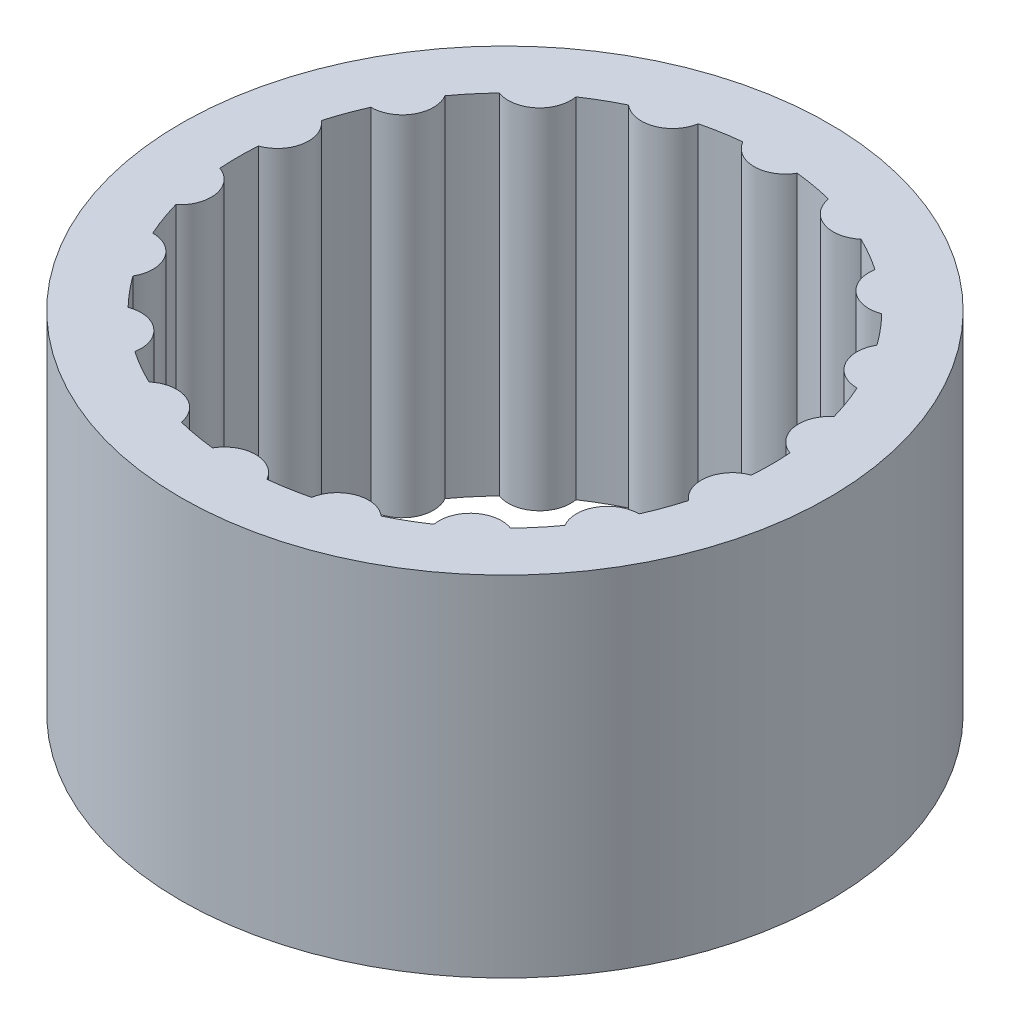
from build123d import *
from OCP.BRepAlgoAPI import BRepAlgoAPI_Cut
from OCP.TopTools import TopTools_ListOfShape

# Parameters (mm, degrees)
SKETCH1_R           = 10.31875
SKETCH1_R_2         = 7.9375
BOSS_EXTRUDE1_DEPTH = 11.1125
CUT_EXTRUDE1_DEPTH  = 11.1125


with BuildPart() as part:
    # Sketch1 → Boss-Extrude1 (new body)
    with BuildSketch(Plane(origin=(0, 0, 0), x_dir=(1, 0, 0), z_dir=(0, 1, 0))):
        Circle(SKETCH1_R)
        Circle(SKETCH1_R_2, mode=Mode.SUBTRACT)
    extrude(amount=BOSS_EXTRUDE1_DEPTH)


with BuildPart() as cut_extrude1_tool:
    # Sketch2 → Cut-Extrude1 (new body)
    with BuildSketch(Plane(origin=(0, 11.1125, 0), x_dir=(1, 0, 0), z_dir=(0, 1, 0))):
        with BuildLine():
            ThreePointArc((7.816908652, 1.378331901), (7.937497068, 0), (7.816908652, -1.378331901))
            ThreePointArc((7.816908652, -1.378331901), (8.037089612, -0.908786504), (8.463813852, -0.614068064))
            ThreePointArc((8.463813852, -0.614068064), (8.4860606, 0), (8.463813852, 0.614068064))
            ThreePointArc((8.463813852, 0.614068064), (8.037089612, 0.908786504), (7.816908652, 1.378331901))
        make_face()
        with BuildLine():
            ThreePointArc((6.874074104, 3.968748534), (7.458807423, 2.714783885), (7.816908652, 1.378331901))
            ThreePointArc((7.816908652, 1.378331901), (7.863217092, 1.89486657), (8.163407067, 2.317759598))
            ThreePointArc((8.163407067, 2.317759598), (7.974288525, 2.902403663), (7.743359773, 3.471830055))
            ThreePointArc((7.743359773, 3.471830055), (7.241570511, 3.602826513), (6.874074104, 3.968748534))
        make_face()
        with BuildLine():
            ThreePointArc((8.163407067, -2.317759598), (7.863217092, -1.89486657), (7.816908652, -1.378331901))
            ThreePointArc((7.816908652, -1.378331901), (7.458807423, -2.714783885), (6.874074104, -3.968748534))
            ThreePointArc((6.874074104, -3.968748534), (7.241570511, -3.602826513), (7.743359773, -3.471830055))
            ThreePointArc((7.743359773, -3.471830055), (7.974288525, -2.902403663), (8.163407067, -2.317759598))
        make_face()
        with BuildLine():
            ThreePointArc((5.102124767, 6.080475521), (6.080475521, 5.102124767), (6.874074104, 3.968748534))
            ThreePointArc((6.874074104, 3.968748534), (6.740924541, 4.469970769), (6.878372912, 4.970031246))
            ThreePointArc((6.878372912, 4.970031246), (6.500699566, 5.454734609), (6.088942225, 5.910838103))
            ThreePointArc((6.088942225, 5.910838103), (5.572611132, 5.862312472), (5.102124767, 6.080475521))
        make_face()
        with BuildLine():
            ThreePointArc((6.878372912, -4.970031246), (6.740924541, -4.469970769), (6.874074104, -3.968748534))
            ThreePointArc((6.874074104, -3.968748534), (6.080475521, -5.102124767), (5.102124767, -6.080475521))
            ThreePointArc((5.102124767, -6.080475521), (5.572611132, -5.862312472), (6.088942225, -5.910838103))
            ThreePointArc((6.088942225, -5.910838103), (6.500699566, -5.454734609), (6.878372912, -4.970031246))
        make_face()
        with BuildLine():
            ThreePointArc((2.714783885, 7.458807423), (3.968748534, 6.874074104), (5.102124767, 6.080475521))
            ThreePointArc((5.102124767, 6.080475521), (4.805577005, 6.505930525), (4.763705469, 7.022843776))
            ThreePointArc((4.763705469, 7.022843776), (4.2430303, 7.349144057), (3.700108383, 7.636911841))
            ThreePointArc((3.700108383, 7.636911841), (3.231512607, 7.414717029), (2.714783885, 7.458807423))
        make_face()
        with BuildLine():
            ThreePointArc((4.763705469, -7.022843776), (4.805577005, -6.505930525), (5.102124767, -6.080475521))
            ThreePointArc((5.102124767, -6.080475521), (3.968748534, -6.874074104), (2.714783885, -7.458807423))
            ThreePointArc((2.714783885, -7.458807423), (3.231512607, -7.414717029), (3.700108383, -7.636911841))
            ThreePointArc((3.700108383, -7.636911841), (4.2430303, -7.349144057), (4.763705469, -7.022843776))
        make_face()
        with BuildLine():
            ThreePointArc((0, 7.937497068), (1.378331901, 7.816908652), (2.714783885, 7.458807423))
            ThreePointArc((2.714783885, 7.458807423), (2.29060596, 7.757179042), (2.074464842, 8.228597701))
            ThreePointArc((2.074464842, 8.228597701), (1.473588959, 8.357138271), (0.864986861, 8.441861301))
            ThreePointArc((0.864986861, 8.441861301), (0.50064597, 8.072797282), (0, 7.937497068))
        make_face()
        with BuildLine():
            ThreePointArc((2.074464842, -8.228597701), (2.29060596, -7.757179042), (2.714783885, -7.458807423))
            ThreePointArc((2.714783885, -7.458807423), (1.378331901, -7.816908652), (0, -7.937497068))
            ThreePointArc((0, -7.937497068), (0.50064597, -8.072797282), (0.864986861, -8.441861301))
            ThreePointArc((0.864986861, -8.441861301), (1.473588959, -8.357138271), (2.074464842, -8.228597701))
        make_face()
        with BuildLine():
            ThreePointArc((-2.714783885, 7.458807423), (-1.378331901, 7.816908652), (0, 7.937497068))
            ThreePointArc((0, 7.937497068), (-0.50064597, 8.072797282), (-0.864986861, 8.441861301))
            ThreePointArc((-0.864986861, 8.441861301), (-1.473588959, 8.357138271), (-2.074464842, 8.228597701))
            ThreePointArc((-2.074464842, 8.228597701), (-2.29060596, 7.757179042), (-2.714783885, 7.458807423))
        make_face()
        with BuildLine():
            ThreePointArc((-0.864986861, -8.441861301), (-0.50064597, -8.072797282), (0, -7.937497068))
            ThreePointArc((0, -7.937497068), (-1.378331901, -7.816908652), (-2.714783885, -7.458807423))
            ThreePointArc((-2.714783885, -7.458807423), (-2.29060596, -7.757179042), (-2.074464842, -8.228597701))
            ThreePointArc((-2.074464842, -8.228597701), (-1.473588959, -8.357138271), (-0.864986861, -8.441861301))
        make_face()
        with BuildLine():
            ThreePointArc((-5.102124767, 6.080475521), (-3.968748534, 6.874074104), (-2.714783885, 7.458807423))
            ThreePointArc((-2.714783885, 7.458807423), (-3.231512607, 7.414717029), (-3.700108383, 7.636911841))
            ThreePointArc((-3.700108383, 7.636911841), (-4.2430303, 7.349144057), (-4.763705469, 7.022843776))
            ThreePointArc((-4.763705469, 7.022843776), (-4.805577005, 6.505930525), (-5.102124767, 6.080475521))
        make_face()
        with BuildLine():
            ThreePointArc((-3.700108383, -7.636911841), (-3.231512607, -7.414717029), (-2.714783885, -7.458807423))
            ThreePointArc((-2.714783885, -7.458807423), (-3.968748534, -6.874074104), (-5.102124767, -6.080475521))
            ThreePointArc((-5.102124767, -6.080475521), (-4.805577005, -6.505930525), (-4.763705469, -7.022843776))
            ThreePointArc((-4.763705469, -7.022843776), (-4.2430303, -7.349144057), (-3.700108383, -7.636911841))
        make_face()
        with BuildLine():
            ThreePointArc((-6.874074104, 3.968748534), (-6.080475521, 5.102124767), (-5.102124767, 6.080475521))
            ThreePointArc((-5.102124767, 6.080475521), (-5.572611132, 5.862312472), (-6.088942225, 5.910838103))
            ThreePointArc((-6.088942225, 5.910838103), (-6.500699566, 5.454734609), (-6.878372912, 4.970031246))
            ThreePointArc((-6.878372912, 4.970031246), (-6.740924541, 4.469970769), (-6.874074104, 3.968748534))
        make_face()
        with BuildLine():
            ThreePointArc((-6.088942225, -5.910838103), (-5.572611132, -5.862312472), (-5.102124767, -6.080475521))
            ThreePointArc((-5.102124767, -6.080475521), (-6.080475521, -5.102124767), (-6.874074104, -3.968748534))
            ThreePointArc((-6.874074104, -3.968748534), (-6.740924541, -4.469970769), (-6.878372912, -4.970031246))
            ThreePointArc((-6.878372912, -4.970031246), (-6.500699566, -5.454734609), (-6.088942225, -5.910838103))
        make_face()
        with BuildLine():
            ThreePointArc((-7.816908652, 1.378331901), (-7.458807423, 2.714783885), (-6.874074104, 3.968748534))
            ThreePointArc((-6.874074104, 3.968748534), (-7.241570511, 3.602826513), (-7.743359773, 3.471830055))
            ThreePointArc((-7.743359773, 3.471830055), (-7.974288525, 2.902403663), (-8.163407067, 2.317759598))
            ThreePointArc((-8.163407067, 2.317759598), (-7.863217092, 1.89486657), (-7.816908652, 1.378331901))
        make_face()
        with BuildLine():
            ThreePointArc((-7.743359773, -3.471830055), (-7.241570511, -3.602826513), (-6.874074104, -3.968748534))
            ThreePointArc((-6.874074104, -3.968748534), (-7.458807423, -2.714783885), (-7.816908652, -1.378331901))
            ThreePointArc((-7.816908652, -1.378331901), (-7.863217092, -1.89486657), (-8.163407067, -2.317759598))
            ThreePointArc((-8.163407067, -2.317759598), (-7.974288525, -2.902403663), (-7.743359773, -3.471830055))
        make_face()
        with BuildLine():
            ThreePointArc((-7.816908652, -1.378331901), (-7.937497068, 0), (-7.816908652, 1.378331901))
            ThreePointArc((-7.816908652, 1.378331901), (-8.037089612, 0.908786504), (-8.463813852, 0.614068064))
            ThreePointArc((-8.463813852, 0.614068064), (-8.4860606, 0), (-8.463813852, -0.614068064))
            ThreePointArc((-8.463813852, -0.614068064), (-8.037089612, -0.908786504), (-7.816908652, -1.378331901))
        make_face()
    extrude(amount=-CUT_EXTRUDE1_DEPTH)


with BuildPart() as part_1:
    add(part.part)

    # Cut-Extrude1: cut by cut_extrude1_tool, with a tolerance
    cut_extrude1_stock = TopTools_ListOfShape()
    cut_extrude1_stock.Append(part_1.part.wrapped)
    cut_extrude1_tools = TopTools_ListOfShape()
    cut_extrude1_tools.Append(cut_extrude1_tool.part.wrapped)
    cut_extrude1_cut = BRepAlgoAPI_Cut()
    cut_extrude1_cut.SetArguments(cut_extrude1_stock)
    cut_extrude1_cut.SetTools(cut_extrude1_tools)
    cut_extrude1_cut.SetFuzzyValue(0.00001)
    cut_extrude1_cut.Build()
    add(Compound.cast(cut_extrude1_cut.Shape()).solids(), mode=Mode.REPLACE)


solid = part_1.part
